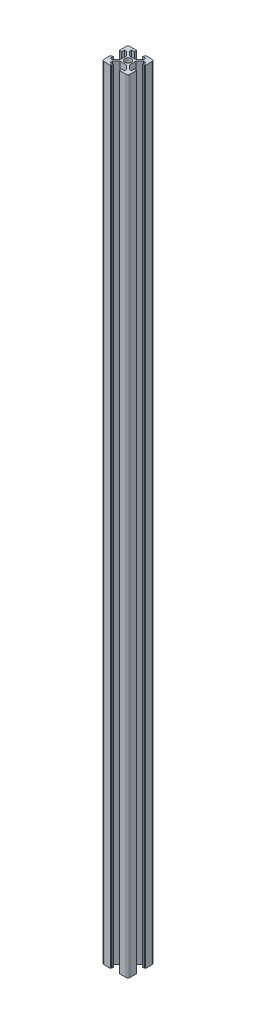
from build123d import *

# Parameters (mm, degrees)
SKETCH_1_R          = 2.5
EXTRUDE_1_DEPTH     = 600
SKETCH_2_R          = 1.75
CUT_EXTRUDE_1_DEPTH = 21


with BuildPart() as part:
    # 草图1 → 凸台-拉伸1 (new body)
    with BuildSketch(Plane(origin=(0, 0, 0), x_dir=(1, 0, 0), z_dir=(0, 1, 0))):
        with BuildLine():
            Line((-5.825824942, 5.993206118), (-5.825824942, 0.914526462))
            Line((-5.825824942, 0.914526462), (-8.786485114, -2.04613371))
            Line((-8.786485114, -2.04613371), (-10.425824942, -2.04613371))
            Line((-10.425824942, -2.04613371), (-10.425824942, 0.35386629))
            Line((-10.425824942, 0.35386629), (-11.425824942, 0.35386629))
            Line((-11.425824942, 0.35386629), (-11.425824942, -0.14613371))
            Line((-11.425824942, -0.14613371), (-12.225824942, -0.14613371))
            Line((-12.225824942, -0.14613371), (-12.225824942, -5.04613371))
            ThreePointArc((-12.225824942, -5.04613371), (-11.786485114, -6.106793882), (-10.725824942, -6.54613371))
            Line((-10.725824942, -6.54613371), (-5.825824942, -6.54613371))
            Line((-5.825824942, -6.54613371), (-5.825824942, -5.74613371))
            Line((-5.825824942, -5.74613371), (-5.325824942, -5.74613371))
            Line((-5.325824942, -5.74613371), (-5.325824942, -4.74613371))
            Line((-5.325824942, -4.74613371), (-7.725824942, -4.74613371))
            Line((-7.725824942, -4.74613371), (-7.725824942, -3.106793882))
            Line((-7.725824942, -3.106793882), (-4.765164771, -0.14613371))
            Line((-4.765164771, -0.14613371), (0.313514886, -0.14613371))
            Line((0.313514886, -0.14613371), (3.274175058, -3.106793882))
            Line((3.274175058, -3.106793882), (3.274175058, -4.74613371))
            Line((3.274175058, -4.74613371), (0.874175058, -4.74613371))
            Line((0.874175058, -4.74613371), (0.874175058, -5.74613371))
            Line((0.874175058, -5.74613371), (1.374175058, -5.74613371))
            Line((1.374175058, -5.74613371), (1.374175058, -6.54613371))
            Line((1.374175058, -6.54613371), (6.274175058, -6.54613371))
            ThreePointArc((6.274175058, -6.54613371), (7.334835229, -6.106793882), (7.774175058, -5.04613371))
            Line((7.774175058, -5.04613371), (7.774175058, -0.14613371))
            Line((7.774175058, -0.14613371), (6.974175058, -0.14613371))
            Line((6.974175058, -0.14613371), (6.974175058, 0.35386629))
            Line((6.974175058, 0.35386629), (5.974175058, 0.35386629))
            Line((5.974175058, 0.35386629), (5.974175058, -2.04613371))
            Line((5.974175058, -2.04613371), (4.334835229, -2.04613371))
            Line((4.334835229, -2.04613371), (1.374175058, 0.914526462))
            Line((1.374175058, 0.914526462), (1.374175058, 5.993206118))
            Line((1.374175058, 5.993206118), (4.334835229, 8.95386629))
            Line((4.334835229, 8.95386629), (5.974175058, 8.95386629))
            Line((5.974175058, 8.95386629), (5.974175058, 6.55386629))
            Line((5.974175058, 6.55386629), (6.974175058, 6.55386629))
            Line((6.974175058, 6.55386629), (6.974175058, 7.05386629))
            Line((6.974175058, 7.05386629), (7.774175058, 7.05386629))
            Line((7.774175058, 7.05386629), (7.774175058, 11.95386629))
            ThreePointArc((7.774175058, 11.95386629), (7.334835229, 13.014526462), (6.274175058, 13.45386629))
            Line((6.274175058, 13.45386629), (1.374175058, 13.45386629))
            Line((1.374175058, 13.45386629), (1.374175058, 12.65386629))
            Line((1.374175058, 12.65386629), (0.874175058, 12.65386629))
            Line((0.874175058, 12.65386629), (0.874175058, 11.65386629))
            Line((0.874175058, 11.65386629), (3.274175058, 11.65386629))
            Line((3.274175058, 11.65386629), (3.274175058, 10.014526462))
            Line((3.274175058, 10.014526462), (0.313514886, 7.05386629))
            Line((0.313514886, 7.05386629), (-4.765164771, 7.05386629))
            Line((-4.765164771, 7.05386629), (-7.725824942, 10.014526462))
            Line((-7.725824942, 10.014526462), (-7.725824942, 11.65386629))
            Line((-7.725824942, 11.65386629), (-5.325824942, 11.65386629))
            Line((-5.325824942, 11.65386629), (-5.325824942, 12.65386629))
            Line((-5.325824942, 12.65386629), (-5.825824942, 12.65386629))
            Line((-5.825824942, 12.65386629), (-5.825824942, 13.45386629))
            Line((-5.825824942, 13.45386629), (-10.725824942, 13.45386629))
            ThreePointArc((-10.725824942, 13.45386629), (-11.786485114, 13.014526462), (-12.225824942, 11.95386629))
            Line((-12.225824942, 11.95386629), (-12.225824942, 7.05386629))
            Line((-12.225824942, 7.05386629), (-11.425824942, 7.05386629))
            Line((-11.425824942, 7.05386629), (-11.425824942, 6.55386629))
            Line((-11.425824942, 6.55386629), (-10.425824942, 6.55386629))
            Line((-10.425824942, 6.55386629), (-10.425824942, 8.95386629))
            Line((-10.425824942, 8.95386629), (-8.786485114, 8.95386629))
            Line((-8.786485114, 8.95386629), (-5.825824942, 5.993206118))
        make_face()
        with Locations((-2.225824942, 3.45386629)):
            Circle(SKETCH_1_R, mode=Mode.SUBTRACT)
    extrude(amount=EXTRUDE_1_DEPTH)

    # 草图2 → 切除-拉伸1 (cut)
    with BuildSketch(Plane(origin=(0, 0, -7.05386629), x_dir=(-1, 0, 0), z_dir=(0, 0, -1))):
        with Locations((2.225824942, 130)):
            Circle(SKETCH_2_R)
        with Locations((2.225824942, 470)):
            Circle(SKETCH_2_R)
    extrude(amount=-CUT_EXTRUDE_1_DEPTH, mode=Mode.SUBTRACT)


solid = part.part
